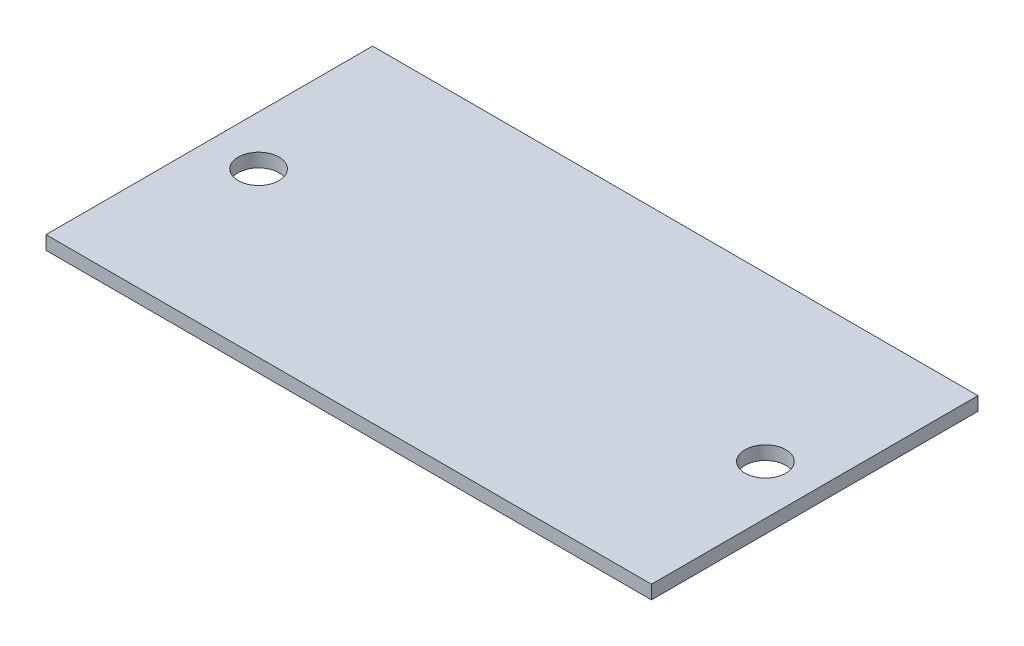
from build123d import *

# Parameters (mm, degrees)
SKETCH1_W           = 44.5
SKETCH1_H           = 24
SKETCH1_R           = 1.5
BOSS_EXTRUDE1_DEPTH = 1


with BuildPart() as part:
    # Sketch1 → Boss-Extrude1 (new body)
    with BuildSketch(Plane(origin=(0, 0, 0), x_dir=(1, 0, 0), z_dir=(0, 1, 0))):
        Rectangle(SKETCH1_W, SKETCH1_H)
        with Locations((18.625, 0)):
            Circle(SKETCH1_R, mode=Mode.SUBTRACT)
        with Locations((-18.625, 0)):
            Circle(SKETCH1_R, mode=Mode.SUBTRACT)
    extrude(amount=BOSS_EXTRUDE1_DEPTH)


solid = part.part
